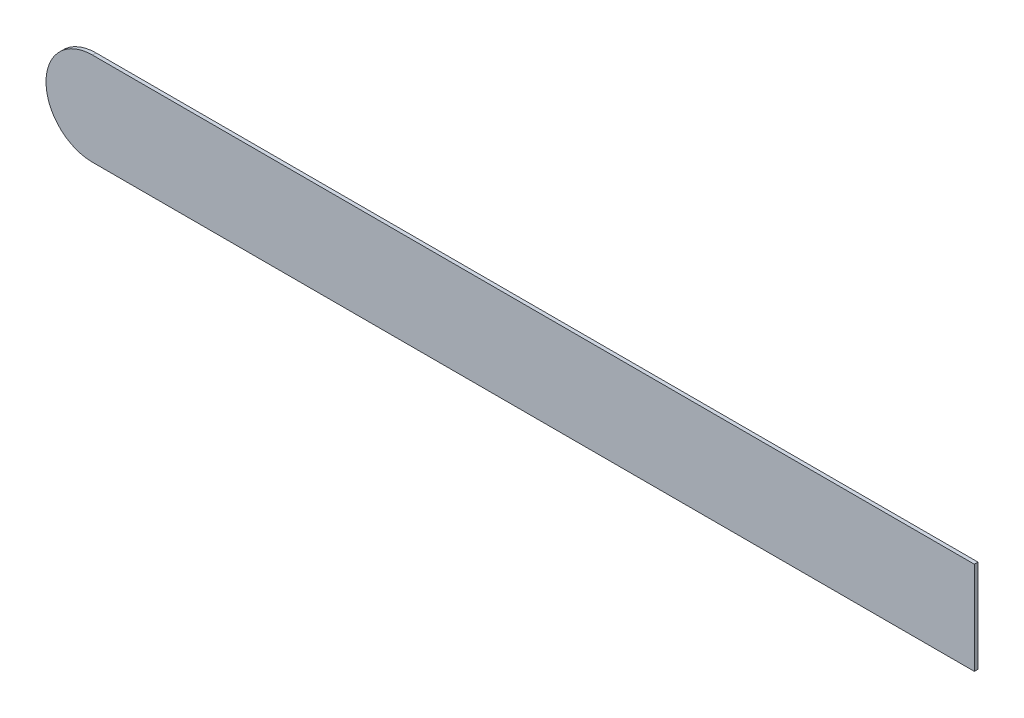
from build123d import *

# Parameters (mm, degrees)
SKETCH1_W          = 127
SKETCH1_H          = 0.5
BASE_EXTRUDE_DEPTH = 6.35
FILLET1_R          = 6.35


with BuildPart() as part:
    # Sketch1 → Base-Extrude (new, symmetric)
    with BuildSketch(Plane(origin=(0, 0, 0), x_dir=(1, 0, 0), z_dir=(0, 1, 0))):
        Rectangle(SKETCH1_W, SKETCH1_H)
    extrude(amount=BASE_EXTRUDE_DEPTH, both=True)

    # Fillet1
    fillet1_edges = [part.edges().sort_by_distance(p)[0] for p in [
        (-63.5, 6.35, 0),
        (-63.5, -6.35, 0),
    ]]
    fillet(fillet1_edges, radius=FILLET1_R - 0.0001)  # a hair under: the kernel refuses the full size


solid = part.part
